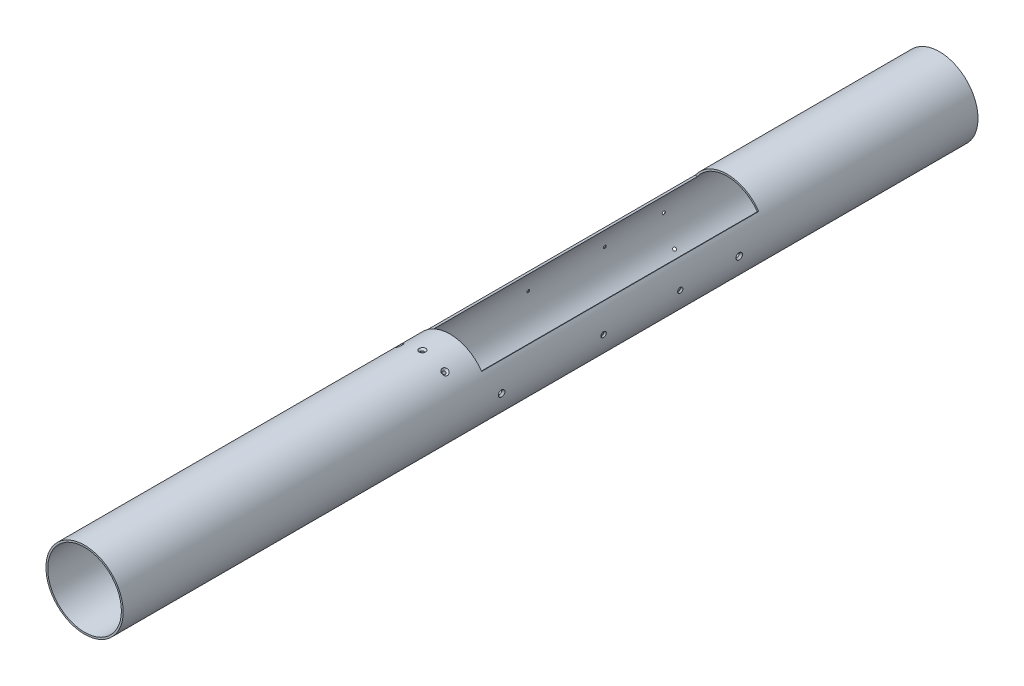
from build123d import *

# Parameters (mm, degrees)
IZIM1_R                                     = 65.5
IZIM1_R_2                                   = 62.5
EKSTR_ZYON_NCE1_DEPTH                       = 1450
DAIRESEL_KAPLAMA2_COUNT                     = 8
DAIRESEL_KAPLAMA3_COUNT                     = 8
M4_ALT_GEN_ALYAN_HAV_A_BA_L_K_R_VID_2_COUNT = 2
M4_ALT_GEN_ALYAN_HAV_A_BA_L_K_R_VID_2_PITCH = 130
DAIRESEL_KAPLAMA4_COUNT                     = 4
Y_KSEKLIK_EKSTR_ZYON1_START                 = -1090
Y_KSEKLIK_EKSTR_ZYON1_DEPTH                 = 470
KES_EKSTR_ZYON1_START                       = -1090
KES_EKSTR_ZYON1_DEPTH                       = 470
IZIM20_R                                    = 10.5
KES_EKSTR_ZYON3_DEPTH                       = 10


with BuildPart() as part:
    # Çizim1 → Ekstrüzyon-İnce1 (new body)
    with BuildSketch(Plane.XY):
        Circle(IZIM1_R)
        Circle(IZIM1_R_2, mode=Mode.SUBTRACT)
    extrude(amount=EKSTR_ZYON_NCE1_DEPTH)

    # Çizim3 → M5 Alt_gen Alyan Hav_a Ba_l_ K_r Vida _i (revolve, cut)
    with BuildSketch(Plane(origin=(0, 65.5, 877), x_dir=(0, 0, 1), z_dir=(1, 0, 0))):
        Polygon((0, 0), (0, 13.89228064), (2.65, 12.3), (2.65, 2.95), (5.6, 0), align=None)
    revolve(axis=Axis((0, 71.85, 877), (0, -1, 0)), mode=Mode.SUBTRACT)

    # Dairesel Kaplama1: read off the stored shape, not the designer's step
    # Dairesel Kaplama1 outline → Dairesel Kaplama1 (revolve, cut)
    with BuildSketch(Plane.XY.offset(877)):
        Polygon((2.65, -62.55), (2.65, -62.443786933), (0, -62.443786933), (0, -65.500033663), (5.600033663, -65.500033663), align=None)
    revolve(axis=Axis((0, 0, 877), (0, 1, 0)), mode=Mode.SUBTRACT)

    # Dairesel Kaplama1 2 outline → Dairesel Kaplama1 2 (revolve, cut)
    with BuildSketch(Plane(origin=(0, 0, 877), x_dir=(0.8090169943749467, 0.5877852522924741, 0), z_dir=(0, 0, -1))):
        Polygon((0, -65.500117297), (5.600122769, -65.500117297), (2.65, -62.55), (2.65, -62.4437645), (0, -62.4437645), align=None)
        Polygon((0, 62.4437645), (2.65, 62.4437645), (2.65, 62.55), (5.600128241, 65.500128241), (0, 65.500128241), align=None)
    revolve(axis=Axis((0, 0, 877), (0.5877852522924741, -0.8090169943749467, 0)), mode=Mode.SUBTRACT)

    # Dairesel Kaplama1 3 outline → Dairesel Kaplama1 3 (revolve, cut)
    with BuildSketch(Plane(origin=(0, 0, 877), x_dir=(0.8090169943749506, -0.5877852522924688, 0), z_dir=(0, 0, 1))):
        Polygon((0, -65.500093701), (5.600111775, -65.500093701), (2.65, -62.55), (2.65, -62.4437645), (0, -62.4437645), align=None)
        Polygon((0, 62.4437645), (2.65, 62.4437645), (2.65, 62.55), (5.600129848, 65.500129848), (0, 65.500129848), align=None)
    revolve(axis=Axis((0, 0, 877), (0.5877852522924688, 0.8090169943749506, 0)), mode=Mode.SUBTRACT)

    # Çizim6 → M5 Alt_gen Alyan Hav_a Ba_l_ K_r Vid 2 (revolve, cut)
    with BuildSketch(Plane(origin=(0, 65.5, 808), x_dir=(0, 0, 1), z_dir=(1, 0, 0))):
        Polygon((0, 0), (0, 13.89228064), (2.65, 12.3), (2.65, 2.95), (5.6, 0), align=None)
    m5_alt_gen_alyan_hav_a_ba_l_k_r_vid_2 = revolve(axis=Axis((0, 71.85, 808), (0, -1, 0)), mode=Mode.SUBTRACT)

    # Dairesel Kaplama2: M5 Alt_gen Alyan Hav_a Ba_l_ K_r Vid 2 ×8 about axis
    dairesel_kaplama2_axis = Axis((0, 0, 1450), (0, 0, 1))
    for i in range(1, DAIRESEL_KAPLAMA2_COUNT):
        add(m5_alt_gen_alyan_hav_a_ba_l_k_r_vid_2.rotate(dairesel_kaplama2_axis, i * 360 / DAIRESEL_KAPLAMA2_COUNT), mode=Mode.SUBTRACT)

    # Çizim8 → M5 Alt_gen Alyan Hav_a Ba_l_ K_r Vid 3 (revolve, cut)
    with BuildSketch(Plane(origin=(0, 65.5, 405), x_dir=(0, 0, 1), z_dir=(1, 0, 0))):
        Polygon((0, 0), (0, 13.89228064), (2.65, 12.3), (2.65, 2.95), (5.6, 0), align=None)
    m5_alt_gen_alyan_hav_a_ba_l_k_r_vid_3 = revolve(axis=Axis((0, 71.85, 405), (0, -1, 0)), mode=Mode.SUBTRACT)

    # Dairesel Kaplama3: M5 Alt_gen Alyan Hav_a Ba_l_ K_r Vid 3 ×8 about axis
    dairesel_kaplama3_axis = Axis((0, 0, 1450), (0, 0, 1))
    for i in range(1, DAIRESEL_KAPLAMA3_COUNT):
        add(m5_alt_gen_alyan_hav_a_ba_l_k_r_vid_3.rotate(dairesel_kaplama3_axis, i * 360 / DAIRESEL_KAPLAMA3_COUNT), mode=Mode.SUBTRACT)

    # Çizim10 → M4 Altıgen Alyan Havşa Başlı Kör Vida İçin Havşa2 (revolve, cut)
    with BuildSketch(Plane(origin=(0, 65.5, 505), x_dir=(0, 0, 1), z_dir=(1, 0, 0))):
        Polygon((0, 0), (0, 12.851936393), (2.25, 11.5), (2.25, 2.23), (4.48, 0), align=None)
    m4_alt_gen_alyan_hav_a_ba_l_k_r_vida_i = revolve(axis=Axis((0, 71.85, 505), (0, -1, 0)), mode=Mode.SUBTRACT)

    # M4 Alt_gen Alyan Hav_a Ba_l_ K_r Vid 2: M4 Altıgen Alyan Havşa Başlı Kör Vida İçin Havşa2 ×2
    with Locations(*[(0, 0, i * M4_ALT_GEN_ALYAN_HAV_A_BA_L_K_R_VID_2_PITCH) for i in range(1, M4_ALT_GEN_ALYAN_HAV_A_BA_L_K_R_VID_2_COUNT)]):
        add(m4_alt_gen_alyan_hav_a_ba_l_k_r_vida_i, mode=Mode.SUBTRACT)

    # Dairesel Kaplama4: M4 Altıgen Alyan Havşa Başlı Kör Vida İçin Havşa2 ×4 about axis
    dairesel_kaplama4_axis = Axis((0, 0, 1450), (0, 0, 1))
    for i in range(1, DAIRESEL_KAPLAMA4_COUNT):
        add(m4_alt_gen_alyan_hav_a_ba_l_k_r_vida_i.rotate(dairesel_kaplama4_axis, i * 360 / DAIRESEL_KAPLAMA4_COUNT), mode=Mode.SUBTRACT)

    # Dairesel Kaplama4 copy 1 sketch → Dairesel Kaplama4 copy 1 (revolve, cut)
    with BuildSketch(Plane(origin=(-65.5, 0, 635), x_dir=(0, 0, 1), z_dir=(0, 1, 0))):
        Polygon((0, 0), (0, 12.851936393), (2.25, 11.5), (2.25, 2.23), (4.48, 0), align=None)
    revolve(axis=Axis((-71.85, 0, 635), (1, 0, 0)), mode=Mode.SUBTRACT)

    # Dairesel Kaplama4 copy 2 sketch → Dairesel Kaplama4 copy 2 (revolve, cut)
    with BuildSketch(Plane(origin=(0, -65.5, 635), x_dir=(0, 0, 1), z_dir=(-1, 0, 0))):
        Polygon((0, 0), (0, 12.851936393), (2.25, 11.5), (2.25, 2.23), (4.48, 0), align=None)
    revolve(axis=Axis((0, -71.85, 635), (0, 1, 0)), mode=Mode.SUBTRACT)

    # Dairesel Kaplama4 copy 3 sketch → Dairesel Kaplama4 copy 3 (revolve, cut)
    with BuildSketch(Plane(origin=(65.5, 0, 635), x_dir=(0, 0, 1), z_dir=(0, -1, 0))):
        Polygon((0, 0), (0, 12.851936393), (2.25, 11.5), (2.25, 2.23), (4.48, 0), align=None)
    revolve(axis=Axis((71.85, 0, 635), (-1, 0, 0)), mode=Mode.SUBTRACT)

    # Çizim12 → Yükseklik-Ekstrüzyon1 (add)
    with BuildSketch(Plane.XY.offset(1450).offset(Y_KSEKLIK_EKSTR_ZYON1_START)):
        with BuildLine():
            Line((-53.654458901, 37.569256581), (-51.197002768, 35.848527272))
            ThreePointArc((-51.197002768, 35.848527272), (0, 62.5), (51.197002768, 35.848527272))
            Line((51.197002768, 35.848527272), (53.654458901, 37.569256581))
            ThreePointArc((53.654458901, 37.569256581), (0, 65.5), (-53.654458901, 37.569256581))
        make_face()
    extrude(amount=Y_KSEKLIK_EKSTR_ZYON1_DEPTH)

    # Çizim14 → Kes-Ekstrüzyon1 (cut)
    with BuildSketch(Plane.XY.offset(1450).offset(KES_EKSTR_ZYON1_START)):
        with BuildLine():
            Line((-53.654458901, 37.569256581), (-51.197002768, 35.848527272))
            ThreePointArc((-51.197002768, 35.848527272), (0, 62.5), (51.197002768, 35.848527272))
            Line((51.197002768, 35.848527272), (53.654458901, 37.569256581))
            ThreePointArc((53.654458901, 37.569256581), (0, 65.5), (-53.654458901, 37.569256581))
        make_face()
    extrude(amount=KES_EKSTR_ZYON1_DEPTH, mode=Mode.SUBTRACT)

    # Çizim20 → Kes-Ekstrüzyon3 (cut)
    with BuildSketch(Plane(origin=(-65.5, 0, 0), x_dir=(0, 0, -1), z_dir=(1, 0, 0))):
        with Locations(Location((-1010, 0, 0), (0, 0, 180))):
            Circle(IZIM20_R)
    extrude(amount=KES_EKSTR_ZYON3_DEPTH, mode=Mode.SUBTRACT)


solid = part.part
